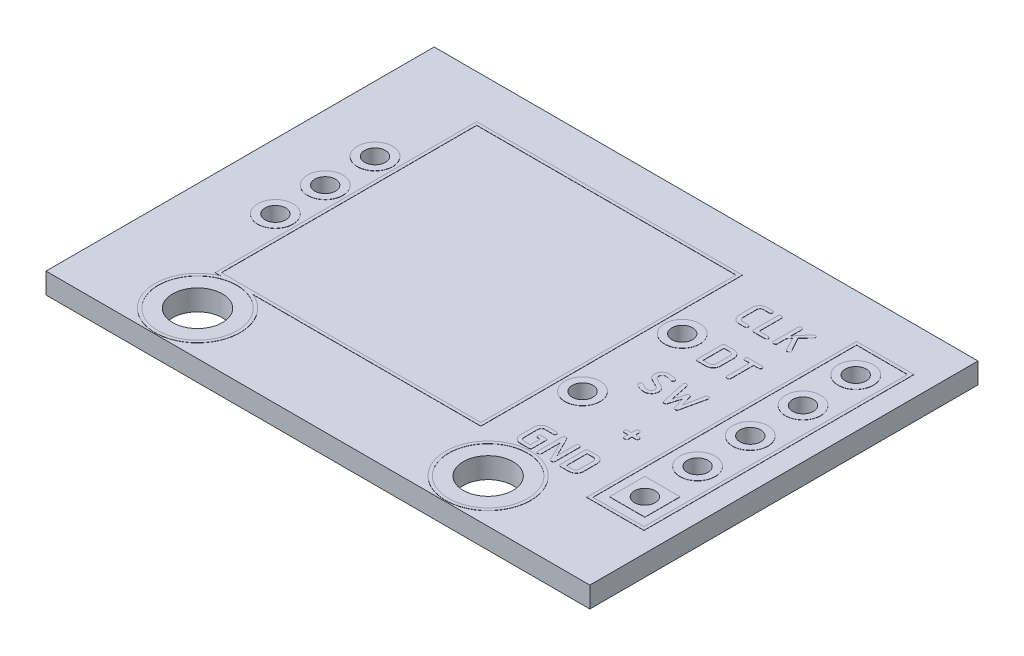
from build123d import *

# Parameters (mm, degrees)
EXTRUDE_1_DEPTH      = 0.5
EXTRUDE_1_DEPTH_BACK = 0.5
SKETCH_1_W           = 26.2
SKETCH_1_H           = 18.7
SKETCH_1_R           = 1.2
SKETCH_1_R_2         = 0.5
SKETCH_2_R           = 0.499436834
CUT_EXTRUDE_1_DEPTH  = 2
SKETCH_6_R           = 0.85
SKETCH_6_R_2         = 0.5
SKETCH_6_R_3         = 0.849436834
SKETCH_6_R_4         = 0.499436834
SKETCH_6_W           = 1.698284278
SKETCH_6_H           = 1.7
EXTRUDE_4_DEPTH      = 0.01
SKETCH_3_R           = 2.05
SKETCH_3_R_2         = 1.9
SKETCH_3_W           = 12.5
SKETCH_3_H           = 12.3
SKETCH_3_W_2         = 2.76
SKETCH_3_H_2         = 13
SKETCH_3_W_3         = 2.46
SKETCH_3_H_3         = 12.7
EXTRUDE_2_DEPTH      = 0.01
EXTRUDE_3_DEPTH      = 0.01


with BuildPart() as part:
    # 草图1 → 凸台-拉伸1 (new, two sides: drawn at the far end of the back side and taken through both)
    with BuildSketch(Plane(origin=(0, 0, 0), x_dir=(1, 0, 0), z_dir=(0, 1, 0)).offset(-EXTRUDE_1_DEPTH_BACK)):
        with Locations((13.1, 9.35)):
            Rectangle(SKETCH_1_W, SKETCH_1_H)
        with Locations((19.2, 2.1)):
            Circle(SKETCH_1_R, mode=Mode.SUBTRACT)
        with Locations((5.2, 2.1)):
            Circle(SKETCH_1_R, mode=Mode.SUBTRACT)
        with Locations((23.85, 5)):
            Circle(SKETCH_1_R_2, mode=Mode.SUBTRACT)
        with Locations((23.85, 7.54)):
            Circle(SKETCH_1_R_2, mode=Mode.SUBTRACT)
        with Locations((23.85, 10.08)):
            Circle(SKETCH_1_R_2, mode=Mode.SUBTRACT)
        with Locations((23.85, 12.62)):
            Circle(SKETCH_1_R_2, mode=Mode.SUBTRACT)
        with Locations((23.85, 15.16)):
            Circle(SKETCH_1_R_2, mode=Mode.SUBTRACT)
    extrude(amount=EXTRUDE_1_DEPTH + EXTRUDE_1_DEPTH_BACK)

    # 草图2 → 切除-拉伸1 (cut)
    with BuildSketch(Plane.XZ.offset(0.5)):
        with Locations((3.15, -7.9)):
            Circle(SKETCH_2_R)
        with Locations((17.95, -7.9)):
            Circle(SKETCH_2_R)
        with Locations((17.95, -12.7)):
            Circle(SKETCH_2_R)
        with Locations((3.15, -10.3)):
            Circle(SKETCH_2_R)
        with Locations((3.15, -12.7)):
            Circle(SKETCH_2_R)
    extrude(amount=-CUT_EXTRUDE_1_DEPTH, mode=Mode.SUBTRACT)

    # 草图6 → 凸台-拉伸4 (add)
    # profile 1 of 10: a face of its own
    with BuildSketch(Plane(origin=(0, 0.5, 0), x_dir=(1, 0, 0), z_dir=(0, 1, 0))):
        with Locations((23.85, 15.16)):
            Circle(SKETCH_6_R)
        with Locations((23.85, 15.16)):
            Circle(SKETCH_6_R_2, mode=Mode.SUBTRACT)
    # profile 2 of 10: a face of its own
    with BuildSketch(Plane(origin=(0, 0.5, 0), x_dir=(1, 0, 0), z_dir=(0, 1, 0))):
        with Locations((23.85, 12.62)):
            Circle(SKETCH_6_R)
        with Locations((23.85, 12.62)):
            Circle(SKETCH_6_R_2, mode=Mode.SUBTRACT)
    # profile 3 of 10: a face of its own
    with BuildSketch(Plane(origin=(0, 0.5, 0), x_dir=(1, 0, 0), z_dir=(0, 1, 0))):
        with Locations((23.85, 10.08)):
            Circle(SKETCH_6_R)
        with Locations((23.85, 10.08)):
            Circle(SKETCH_6_R_2, mode=Mode.SUBTRACT)
    # profile 4 of 10: a face of its own
    with BuildSketch(Plane(origin=(0, 0.5, 0), x_dir=(1, 0, 0), z_dir=(0, 1, 0))):
        with Locations((23.85, 7.54)):
            Circle(SKETCH_6_R)
        with Locations((23.85, 7.54)):
            Circle(SKETCH_6_R_2, mode=Mode.SUBTRACT)
    # profile 5 of 10: a face of its own
    with BuildSketch(Plane(origin=(0, 0.5, 0), x_dir=(1, 0, 0), z_dir=(0, 1, 0))):
        with Locations((3.15, 7.9)):
            Circle(SKETCH_6_R_3)
        with Locations((3.15, 7.9)):
            Circle(SKETCH_6_R_4, mode=Mode.SUBTRACT)
    # profile 6 of 10: a face of its own
    with BuildSketch(Plane(origin=(0, 0.5, 0), x_dir=(1, 0, 0), z_dir=(0, 1, 0))):
        with Locations((17.95, 7.9)):
            Circle(SKETCH_6_R_3)
        with Locations((17.95, 7.9)):
            Circle(SKETCH_6_R_4, mode=Mode.SUBTRACT)
    # profile 7 of 10: a face of its own
    with BuildSketch(Plane(origin=(0, 0.5, 0), x_dir=(1, 0, 0), z_dir=(0, 1, 0))):
        with Locations((17.95, 12.7)):
            Circle(SKETCH_6_R_3)
        with Locations((17.95, 12.7)):
            Circle(SKETCH_6_R_4, mode=Mode.SUBTRACT)
    # profile 8 of 10: a face of its own
    with BuildSketch(Plane(origin=(0, 0.5, 0), x_dir=(1, 0, 0), z_dir=(0, 1, 0))):
        with Locations((3.15, 10.3)):
            Circle(SKETCH_6_R_3)
        with Locations((3.15, 10.3)):
            Circle(SKETCH_6_R_4, mode=Mode.SUBTRACT)
    # profile 9 of 10: a face of its own
    with BuildSketch(Plane(origin=(0, 0.5, 0), x_dir=(1, 0, 0), z_dir=(0, 1, 0))):
        with Locations((3.15, 12.7)):
            Circle(SKETCH_6_R_3)
        with Locations((3.15, 12.7)):
            Circle(SKETCH_6_R_4, mode=Mode.SUBTRACT)
    # profile 10 of 10: a face of its own
    with BuildSketch(Plane(origin=(0, 0.5, 0), x_dir=(1, 0, 0), z_dir=(0, 1, 0))):
        with Locations((23.85, 5)):
            Rectangle(SKETCH_6_W, SKETCH_6_H)
        with Locations((23.85, 5)):
            Circle(SKETCH_6_R_2, mode=Mode.SUBTRACT)
    extrude_4 = extrude(amount=EXTRUDE_4_DEPTH)

    # 镜向1: 凸台-拉伸4 across plane
    add(extrude_4.mirror(Plane.ZX))

    # 草图3 → 凸台-拉伸2 (add)
    # profile 1 of 3: a face of its own
    with BuildSketch(Plane(origin=(0, 0.5, 0), x_dir=(1, 0, 0), z_dir=(0, 1, 0))):
        with Locations((19.2, 2.1)):
            Circle(SKETCH_3_R)
        with Locations((19.2, 2.1)):
            Circle(SKETCH_3_R_2, mode=Mode.SUBTRACT)
    # profile 2 of 3: a face of its own
    with BuildSketch(Plane(origin=(0, 0.5, 0), x_dir=(1, 0, 0), z_dir=(0, 1, 0))):
        with BuildLine():
            Line((16.95, 16.6), (4.15, 16.6))
            Line((4.15, 16.6), (4.15, 4))
            Line((4.15, 4), (4.430259784, 4))
            ThreePointArc((4.430259784, 4), (5.2, 0.05), (5.969740216, 4))
            Line((5.969740216, 4), (16.95, 4))
            Line((16.95, 4), (16.95, 16.6))
        make_face()
        with Locations((5.2, 2.1)):
            Circle(SKETCH_3_R_2, mode=Mode.SUBTRACT)
        with Locations((10.55, 10.3)):
            Rectangle(SKETCH_3_W, SKETCH_3_H, mode=Mode.SUBTRACT)
    # profile 3 of 3: a face of its own
    with BuildSketch(Plane(origin=(0, 0.5, 0), x_dir=(1, 0, 0), z_dir=(0, 1, 0))):
        with Locations((23.85, 10.08)):
            Rectangle(SKETCH_3_W_2, SKETCH_3_H_2)
        with Locations((23.85, 10.08)):
            Rectangle(SKETCH_3_W_3, SKETCH_3_H_3, mode=Mode.SUBTRACT)
    extrude(amount=EXTRUDE_2_DEPTH)

    # 草图4 → 凸台-拉伸3 (add)
    # profile 1 of 11: a face of its own
    with BuildSketch(Plane(origin=(0, 0.5, 0), x_dir=(1, 0, 0), z_dir=(0, 1, 0))):
        with BuildLine():
            Line((20.793402424, 15.176723836), (20.65990912, 15.007069819))
            Line((20.65990912, 15.007069819), (20.65990912, 14.57615464))
            add(Edge.make_bspline(
                [(20.65990912, 14.57615464), (20.659726109, 14.569476232), (20.659378633, 14.55679625), (20.653887314, 14.539236285), (20.645942654, 14.523830586), (20.633492874, 14.51195255), (20.618336627, 14.502234837), (20.599607799, 14.496005691), (20.577854677, 14.491529766), (20.562203407, 14.491299852), (20.553837692, 14.491176961)],
                knots=[0, 0, 0, 0, 1.028054548, 1.951919403, 2.820883235, 3.677544513, 4.578137139, 5.585329752, 6.709341418, 8, 8, 8, 8], degree=3))
            add(Edge.make_bspline(
                [(20.553837692, 14.491176961), (20.547081069, 14.491327286), (20.534220241, 14.491613419), (20.516364836, 14.495902146), (20.501012695, 14.502578346), (20.488382828, 14.511974647), (20.478661696, 14.524381271), (20.471732965, 14.539305561), (20.467940957, 14.556988695), (20.467360299, 14.569507373), (20.467051977, 14.57615464)],
                knots=[0, 0, 0, 0, 1.163568472, 2.214783019, 3.14592832, 4.036996539, 4.900661769, 5.839040936, 6.85255686, 8, 8, 8, 8], degree=3))
            Line((20.467051977, 14.57615464), (20.467051977, 15.756199283))
            add(Edge.make_bspline(
                [(20.467051977, 15.756199283), (20.467362721, 15.762844399), (20.46794794, 15.775359025), (20.471709529, 15.793069179), (20.478774006, 15.807974988), (20.488177735, 15.820695916), (20.501134816, 15.829718266), (20.516344021, 15.836477111), (20.534226388, 15.840733023), (20.547083186, 15.84102406), (20.553837692, 15.841176961)],
                knots=[0, 0, 0, 0, 1.146971392, 2.160070629, 3.098064001, 3.975005754, 4.855365065, 5.786127544, 6.836909906, 8, 8, 8, 8], degree=3))
            add(Edge.make_bspline(
                [(20.553837692, 15.841176961), (20.56220103, 15.841050621), (20.57784785, 15.840814252), (20.599630052, 15.83638052), (20.618215308, 15.83003349), (20.633694626, 15.820757283), (20.645836059, 15.808508113), (20.65390823, 15.793140273), (20.659372562, 15.775551104), (20.659724014, 15.762875424), (20.65990912, 15.756199283)],
                knots=[0, 0, 0, 0, 1.290199789, 2.413811901, 3.420646485, 4.312714334, 5.18011951, 6.04877445, 6.972310897, 8, 8, 8, 8], degree=3))
            Line((20.65990912, 15.756199283), (20.65990912, 15.224335444))
            Line((20.65990912, 15.224335444), (21.149886799, 15.812549729))
            add(Edge.make_bspline(
                [(21.149886799, 15.812549729), (21.154323035, 15.817001228), (21.162875857, 15.825583473), (21.17867965, 15.834502796), (21.195798188, 15.840223101), (21.20789775, 15.840854674), (21.214072067, 15.841176961)],
                knots=[0, 0, 0, 0, 1.037265406, 1.999790961, 2.979308193, 4, 4, 4, 4], degree=3))
            add(Edge.make_bspline(
                [(21.214072067, 15.841176961), (21.222229408, 15.841028367), (21.237665821, 15.840747178), (21.259115017, 15.8365146), (21.277369888, 15.829865046), (21.292730914, 15.820867507), (21.304542938, 15.808391349), (21.312651216, 15.793155887), (21.318095798, 15.775546572), (21.31845016, 15.762873861), (21.318636799, 15.756199283)],
                knots=[0, 0, 0, 0, 1.270448917, 2.404113486, 3.39054033, 4.290589112, 5.154891296, 6.031317705, 6.963116621, 8, 8, 8, 8], degree=3))
            add(Edge.make_bspline(
                [(21.318636799, 15.756199283), (21.318230126, 15.751640429), (21.317375737, 15.742062626), (21.311847793, 15.727537814), (21.302530809, 15.712803075), (21.294556862, 15.70336677), (21.290310906, 15.69834214)],
                knots=[0, 0, 0, 0, 0.831966467, 1.747898068, 2.800804038, 4, 4, 4, 4], degree=3))
            Line((21.290310906, 15.69834214), (20.924183674, 15.298163569))
            Line((20.924183674, 15.298163569), (21.304172513, 14.618040801))
            add(Edge.make_bspline(
                [(21.304172513, 14.618040801), (21.308365999, 14.610595213), (21.315757521, 14.597471469), (21.31776726, 14.582592302), (21.318636799, 14.57615464)],
                knots=[0, 0, 0, 0, 1.134674476, 2, 2, 2, 2], degree=3))
            add(Edge.make_bspline(
                [(21.318636799, 14.57615464), (21.318272383, 14.571482872), (21.317519933, 14.561836539), (21.31150802, 14.547611672), (21.302216127, 14.533374803), (21.289865569, 14.519226955), (21.274581907, 14.506495314), (21.256208504, 14.497781893), (21.235911037, 14.492056458), (21.221547473, 14.49147801), (21.214072067, 14.491176961)],
                knots=[0, 0, 0, 0, 0.756511836, 1.562056281, 2.471351599, 3.511475476, 4.601537416, 5.673641561, 6.789264718, 8, 8, 8, 8], degree=3))
            add(Edge.make_bspline(
                [(21.214072067, 14.491176961), (21.205940442, 14.491596123), (21.190380771, 14.492398178), (21.168977061, 14.501439687), (21.150943286, 14.515773016), (21.142705615, 14.528748465), (21.138435906, 14.535473836)],
                knots=[0, 0, 0, 0, 1.051983491, 2.012945582, 2.970079655, 4, 4, 4, 4], degree=3))
            Line((21.138435906, 14.535473836), (20.793402424, 15.176723836))
        make_face()
    # profile 2 of 11: a face of its own
    with BuildSketch(Plane(origin=(0, 0.5, 0), x_dir=(1, 0, 0), z_dir=(0, 1, 0))):
        with BuildLine():
            add(Edge.make_bspline(
                [(19.502766263, 15.756199283), (19.503077007, 15.762844399), (19.503662225, 15.775359025), (19.507423815, 15.793069179), (19.514488291, 15.807974988), (19.523892021, 15.820695916), (19.536849101, 15.829718266), (19.552058306, 15.836477111), (19.569940674, 15.840733023), (19.582797472, 15.84102406), (19.589551977, 15.841176961)],
                knots=[0, 0, 0, 0, 1.146971392, 2.160070629, 3.098064001, 3.975005754, 4.855365065, 5.786127544, 6.836909906, 8, 8, 8, 8], degree=3))
            add(Edge.make_bspline(
                [(19.589551977, 15.841176961), (19.5979152, 15.841050558), (19.613561804, 15.840814072), (19.635345421, 15.836381105), (19.653926157, 15.830031633), (19.669420036, 15.820763294), (19.681447502, 15.808549636), (19.689704161, 15.793387513), (19.69507068, 15.775843529), (19.695432722, 15.763173688), (19.695623406, 15.756500622)],
                knots=[0, 0, 0, 0, 1.292391348, 2.417912051, 3.426456865, 4.320039998, 5.188918566, 6.045460059, 6.970565243, 8, 8, 8, 8], degree=3))
            Line((19.695623406, 15.756500622), (19.695623406, 14.66474839))
            Line((19.695623406, 14.66474839), (20.118101085, 14.66474839))
            add(Edge.make_bspline(
                [(20.118101085, 14.66474839), (20.126262043, 14.664605384), (20.1417053, 14.664334768), (20.163109352, 14.660032444), (20.181608597, 14.65356716), (20.196577445, 14.643755609), (20.208693094, 14.631355721), (20.216659031, 14.615787339), (20.222157395, 14.597816106), (20.222489675, 14.584840868), (20.222665817, 14.577962676)],
                knots=[0, 0, 0, 0, 1.258373533, 2.381262828, 3.358313866, 4.266397696, 5.122484846, 6.004202786, 6.942024946, 8, 8, 8, 8], degree=3))
            add(Edge.make_bspline(
                [(20.222665817, 14.577962676), (20.222459863, 14.571195054), (20.222065691, 14.558242628), (20.216827736, 14.540249467), (20.208477296, 14.524846345), (20.196802343, 14.512089195), (20.181416318, 14.502832644), (20.163245475, 14.495659343), (20.141635754, 14.492117937), (20.126246197, 14.491502624), (20.118101085, 14.491176961)],
                knots=[0, 0, 0, 0, 1.043515683, 1.997165386, 2.866106551, 3.734353395, 4.634922528, 5.618458819, 6.739540006, 8, 8, 8, 8], degree=3))
            Line((20.118101085, 14.491176961), (19.589551977, 14.491176961))
            add(Edge.make_bspline(
                [(19.589551977, 14.491176961), (19.582795355, 14.491327286), (19.569934527, 14.491613419), (19.552079121, 14.495902146), (19.536726981, 14.502578346), (19.524097114, 14.511974647), (19.514375981, 14.524381271), (19.50744725, 14.539305561), (19.503655242, 14.556988695), (19.503074585, 14.569507373), (19.502766263, 14.57615464)],
                knots=[0, 0, 0, 0, 1.163568472, 2.214783019, 3.14592832, 4.036996539, 4.900661769, 5.839040936, 6.85255686, 8, 8, 8, 8], degree=3))
            Line((19.502766263, 14.57615464), (19.502766263, 15.756199283))
        make_face()
    # profile 3 of 11: a face of its own
    with BuildSketch(Plane(origin=(0, 0.5, 0), x_dir=(1, 0, 0), z_dir=(0, 1, 0))):
        with BuildLine():
            add(Edge.make_bspline(
                [(19.15381537, 15.841176961), (19.161976328, 15.841033955), (19.177419586, 15.84076334), (19.198823638, 15.836461016), (19.217322883, 15.829995731), (19.232291731, 15.82018418), (19.24440738, 15.807784292), (19.252373317, 15.79221591), (19.25787168, 15.774244678), (19.25820396, 15.76126944), (19.258380102, 15.754391247)],
                knots=[0, 0, 0, 0, 1.258373533, 2.381262828, 3.358313866, 4.266397696, 5.122484846, 6.004202786, 6.942024946, 8, 8, 8, 8], degree=3))
            add(Edge.make_bspline(
                [(19.258380102, 15.754391247), (19.258174148, 15.747623625), (19.257779977, 15.734671199), (19.252542022, 15.716678038), (19.244191581, 15.701274916), (19.232516628, 15.688517766), (19.217130604, 15.679261216), (19.198959761, 15.672087915), (19.177350039, 15.668546509), (19.161960483, 15.667931195), (19.15381537, 15.667605533)],
                knots=[0, 0, 0, 0, 1.043515683, 1.997165386, 2.866106551, 3.734353395, 4.634922528, 5.618458819, 6.739540006, 8, 8, 8, 8], degree=3))
            Line((19.15381537, 15.667605533), (18.890143495, 15.667605533))
            add(Edge.make_bspline(
                [(18.890143495, 15.667605533), (18.880133597, 15.667029366), (18.860197559, 15.665881853), (18.831212746, 15.656432961), (18.804271464, 15.640414396), (18.779312161, 15.619330982), (18.757713677, 15.593408612), (18.742534375, 15.562623115), (18.732792194, 15.528373787), (18.731833406, 15.504148435), (18.731337692, 15.49162339)],
                knots=[0, 0, 0, 0, 0.911113442, 1.814603144, 2.745921518, 3.75301959, 4.781250055, 5.796804317, 6.860898865, 8, 8, 8, 8], degree=3))
            Line((18.731337692, 15.49162339), (18.731337692, 14.840730533))
            add(Edge.make_bspline(
                [(18.731337692, 14.840730533), (18.731837229, 14.828207665), (18.732803409, 14.803986524), (18.742530778, 14.769576563), (18.75799309, 14.738790121), (18.77950802, 14.712710485), (18.804717916, 14.691854406), (18.831672704, 14.676058492), (18.86048341, 14.666453744), (18.880230304, 14.665318365), (18.890143495, 14.66474839)],
                knots=[0, 0, 0, 0, 1.139595756, 2.204152357, 3.232462142, 4.261139086, 5.262785444, 6.202445166, 7.097604633, 8, 8, 8, 8], degree=3))
            Line((18.890143495, 14.66474839), (19.15381537, 14.66474839))
            add(Edge.make_bspline(
                [(19.15381537, 14.66474839), (19.161976328, 14.664605384), (19.177419586, 14.664334768), (19.198823638, 14.660032444), (19.217322883, 14.65356716), (19.232291731, 14.643755609), (19.24440738, 14.631355721), (19.252373317, 14.615787339), (19.25787168, 14.597816106), (19.25820396, 14.584840868), (19.258380102, 14.577962676)],
                knots=[0, 0, 0, 0, 1.258373533, 2.381262828, 3.358313866, 4.266397696, 5.122484846, 6.004202786, 6.942024946, 8, 8, 8, 8], degree=3))
            add(Edge.make_bspline(
                [(19.258380102, 14.577962676), (19.258174148, 14.571195054), (19.257779977, 14.558242628), (19.252542022, 14.540249467), (19.244191581, 14.524846345), (19.232516628, 14.512089195), (19.217130604, 14.502832644), (19.198959761, 14.495659343), (19.177350039, 14.492117937), (19.161960483, 14.491502624), (19.15381537, 14.491176961)],
                knots=[0, 0, 0, 0, 1.043515683, 1.997165386, 2.866106551, 3.734353395, 4.634922528, 5.618458819, 6.739540006, 8, 8, 8, 8], degree=3))
            Line((19.15381537, 14.491176961), (18.890143495, 14.491176961))
            add(Edge.make_bspline(
                [(18.890143495, 14.491176961), (18.878271098, 14.491421476), (18.854926262, 14.491902266), (18.820559217, 14.497061313), (18.787362748, 14.504642108), (18.755560103, 14.516051411), (18.724918757, 14.530082095), (18.695890979, 14.547950265), (18.667713538, 14.568307705), (18.641546334, 14.592020644), (18.617496717, 14.617786978), (18.596255703, 14.645237046), (18.57842104, 14.674256202), (18.563931536, 14.704607162), (18.552336796, 14.736042561), (18.544205663, 14.768875088), (18.539241008, 14.80311057), (18.538736914, 14.826450113), (18.538480549, 14.838319819)],
                knots=[0, 0, 0, 0, 1.036146725, 2.037387638, 3.029011966, 4.005699101, 4.983016459, 5.967005002, 6.977732936, 8.015215859, 9.045664413, 10.052883394, 11.041437129, 12.014571659, 12.985964629, 13.962612362, 14.963853275, 16, 16, 16, 16], degree=3))
            Line((18.538480549, 14.838319819), (18.538480549, 15.494034104))
            add(Edge.make_bspline(
                [(18.538480549, 15.494034104), (18.538694923, 15.505810989), (18.539118482, 15.529079637), (18.544751022, 15.563188903), (18.552164048, 15.596275189), (18.563920693, 15.627657605), (18.578425203, 15.65796743), (18.59664719, 15.686611776), (18.617434202, 15.7144807), (18.641869609, 15.73992982), (18.667982184, 15.763637172), (18.695956052, 15.784316761), (18.725261501, 15.801798971), (18.755767639, 15.816399338), (18.787590863, 15.827629206), (18.820645712, 15.83534251), (18.854928976, 15.840442386), (18.878272013, 15.840929322), (18.890143495, 15.841176961)],
                knots=[0, 0, 0, 0, 1.027896695, 2.030907772, 3.014489256, 3.986369227, 4.952086044, 5.945759404, 6.948155796, 7.985119216, 9.023122273, 10.027284869, 11.019289852, 12.00083266, 12.97800945, 13.961590933, 14.963333811, 16, 16, 16, 16], degree=3))
            Line((18.890143495, 15.841176961), (19.15381537, 15.841176961))
        make_face()
    # profile 4 of 11: a face of its own
    with BuildSketch(Plane(origin=(0, 0.5, 0), x_dir=(1, 0, 0), z_dir=(0, 1, 0))):
        with BuildLine():
            add(Edge.make_bspline(
                [(20.465545281, 13.189391247), (20.465669361, 13.196255793), (20.465902126, 13.209133155), (20.470419523, 13.227000209), (20.476753477, 13.242443406), (20.486575697, 13.25492826), (20.498764399, 13.264818191), (20.513963226, 13.271432993), (20.531498592, 13.275748209), (20.544165705, 13.276029237), (20.550824299, 13.276176961)],
                knots=[0, 0, 0, 0, 1.177412005, 2.208734447, 3.152945062, 4.02767554, 4.913099734, 5.825774102, 6.857096544, 8, 8, 8, 8], degree=3))
            Line((20.550824299, 13.276176961), (21.21256537, 13.276176961))
            add(Edge.make_bspline(
                [(21.21256537, 13.276176961), (21.220726328, 13.276033955), (21.236169586, 13.27576334), (21.257573638, 13.271461016), (21.276072883, 13.264995731), (21.291041731, 13.25518418), (21.30315738, 13.242784292), (21.311123317, 13.22721591), (21.31662168, 13.209244678), (21.31695396, 13.19626944), (21.317130102, 13.189391247)],
                knots=[0, 0, 0, 0, 1.258373533, 2.381262828, 3.358313866, 4.266397696, 5.122484846, 6.004202786, 6.942024946, 8, 8, 8, 8], degree=3))
            add(Edge.make_bspline(
                [(21.317130102, 13.189391247), (21.316924148, 13.182623625), (21.316529977, 13.169671199), (21.311292022, 13.151678038), (21.302941581, 13.136274916), (21.291266628, 13.123517766), (21.275880604, 13.114261216), (21.257709761, 13.107087915), (21.236100039, 13.103546509), (21.220710483, 13.102931195), (21.21256537, 13.102605533)],
                knots=[0, 0, 0, 0, 1.043515683, 1.997165386, 2.866106551, 3.734353395, 4.634922528, 5.618458819, 6.739540006, 8, 8, 8, 8], degree=3))
            Line((21.21256537, 13.102605533), (20.987766263, 13.102605533))
            Line((20.987766263, 13.102605533), (20.987766263, 12.010853301))
            add(Edge.make_bspline(
                [(20.987766263, 12.010853301), (20.987575579, 12.004180235), (20.987213537, 11.991510394), (20.981847018, 11.97396641), (20.973590359, 11.958804287), (20.961562893, 11.946590629), (20.946069014, 11.937322289), (20.927488278, 11.930972818), (20.905704661, 11.926539851), (20.890058057, 11.926303365), (20.881694835, 11.926176961)],
                knots=[0, 0, 0, 0, 1.029434757, 1.954539941, 2.811081434, 3.679960002, 4.573543135, 5.582087949, 6.707608652, 8, 8, 8, 8], degree=3))
            add(Edge.make_bspline(
                [(20.881694835, 11.926176961), (20.87494041, 11.926329901), (20.862083768, 11.926621012), (20.844200362, 11.930876436), (20.828994533, 11.937636867), (20.816025822, 11.946653751), (20.806720236, 11.959321237), (20.799494598, 11.974048311), (20.795820998, 11.991700936), (20.795225384, 12.004210744), (20.79490912, 12.010853301)],
                knots=[0, 0, 0, 0, 1.165370898, 2.21821383, 3.150801522, 4.032887205, 4.911548629, 5.835693501, 6.850779413, 8, 8, 8, 8], degree=3))
            Line((20.79490912, 12.010853301), (20.79490912, 13.102605533))
            Line((20.79490912, 13.102605533), (20.550824299, 13.102605533))
            add(Edge.make_bspline(
                [(20.550824299, 13.102605533), (20.544183373, 13.102931982), (20.531578774, 13.103551588), (20.513810231, 13.10713836), (20.498970829, 13.114404444), (20.486348146, 13.123812824), (20.476958657, 13.136583009), (20.470266749, 13.151913197), (20.465982836, 13.16977533), (20.465695983, 13.182635153), (20.465545281, 13.189391247)],
                knots=[0, 0, 0, 0, 1.145312486, 2.173824069, 3.094826245, 3.970499645, 4.859913264, 5.789329549, 6.838592125, 8, 8, 8, 8], degree=3))
        make_face()
    # profile 5 of 11: a face of its own
    with BuildSketch(Plane(origin=(0, 0.5, 0), x_dir=(1, 0, 0), z_dir=(0, 1, 0))):
        with BuildLine():
            add(Edge.make_bspline(
                [(19.367766263, 13.191199283), (19.367899775, 13.19786041), (19.368151803, 13.210434459), (19.372614248, 13.227935422), (19.379090881, 13.243065607), (19.388601079, 13.255579573), (19.401206441, 13.264732071), (19.41615077, 13.27147525), (19.433729466, 13.275735709), (19.446390095, 13.27602493), (19.453045281, 13.276176961)],
                knots=[0, 0, 0, 0, 1.155654958, 2.181502266, 3.120276192, 4.004766136, 4.878658842, 5.80151602, 6.844345042, 8, 8, 8, 8], degree=3))
            Line((19.453045281, 13.276176961), (19.848402424, 13.276176961))
            add(Edge.make_bspline(
                [(19.848402424, 13.276176961), (19.861475817, 13.275921832), (19.887113307, 13.275421513), (19.924653849, 13.270480313), (19.960486192, 13.262351231), (19.994502457, 13.250919228), (20.0268267, 13.236311344), (20.05736278, 13.218490015), (20.086147507, 13.197269323), (20.112684164, 13.172924985), (20.136849041, 13.146690425), (20.158212653, 13.119170712), (20.176006633, 13.090305497), (20.191029488, 13.06048968), (20.202098208, 13.029131434), (20.210207884, 12.996751707), (20.215646888, 12.963267867), (20.216106196, 12.940506194), (20.216337692, 12.929034104)],
                knots=[0, 0, 0, 0, 1.113136271, 2.182908376, 3.21864008, 4.238702795, 5.234322143, 6.235148626, 7.244823614, 8.274494106, 9.297852902, 10.28018464, 11.2370332, 12.182180518, 13.118612311, 14.06282967, 15.023648573, 16, 16, 16, 16], degree=3))
            Line((20.216337692, 12.929034104), (20.216337692, 12.273319819))
            add(Edge.make_bspline(
                [(20.216337692, 12.273319819), (20.216108775, 12.261946999), (20.215654593, 12.239382815), (20.210178154, 12.206213422), (20.202198098, 12.174046624), (20.190563125, 12.143070652), (20.175720911, 12.11308739), (20.15754297, 12.084205846), (20.136370156, 12.056181699), (20.111742136, 12.030050728), (20.084995878, 12.005728949), (20.056111041, 11.984620855), (20.025906788, 11.966107307), (19.993420509, 11.951916432), (19.959604855, 11.940246935), (19.924022918, 11.932282507), (19.886841691, 11.926824856), (19.861380639, 11.92639571), (19.848402424, 11.926176961)],
                knots=[0, 0, 0, 0, 0.969451523, 1.923435434, 2.860952701, 3.793874942, 4.740631744, 5.710916422, 6.701728193, 7.732653437, 8.77043206, 9.781826416, 10.781348464, 11.786477098, 12.800156766, 13.829299079, 14.893532626, 16, 16, 16, 16], degree=3))
            Line((19.848402424, 11.926176961), (19.453045281, 11.926176961))
            add(Edge.make_bspline(
                [(19.453045281, 11.926176961), (19.446387979, 11.926326469), (19.433723324, 11.926610887), (19.41617153, 11.930903441), (19.401083716, 11.937567137), (19.388806848, 11.947088941), (19.37898071, 11.959291933), (19.37263812, 11.974439494), (19.368144698, 11.991913216), (19.367897315, 12.00449135), (19.367766263, 12.01115464)],
                knots=[0, 0, 0, 0, 1.156110421, 2.199350441, 3.122571333, 4.00740987, 4.878494053, 5.817637966, 6.843889579, 8, 8, 8, 8], degree=3))
            Line((19.367766263, 12.01115464), (19.367766263, 13.191199283))
        make_face()
        with BuildLine():
            Line((19.560623406, 13.102605533), (19.560623406, 12.09974839))
            Line((19.560623406, 12.09974839), (19.847498406, 12.09974839))
            add(Edge.make_bspline(
                [(19.847498406, 12.09974839), (19.859218664, 12.100382437), (19.882268974, 12.101629422), (19.915345043, 12.111602868), (19.945675797, 12.128024898), (19.972359644, 12.150573817), (19.994944537, 12.177380065), (20.011616579, 12.207735945), (20.021591662, 12.240964191), (20.022843854, 12.264011699), (20.023480549, 12.275730533)],
                knots=[0, 0, 0, 0, 1.016742171, 1.999633521, 2.971814917, 3.994083713, 5.01635251, 6.000366479, 6.983257829, 8, 8, 8, 8], degree=3))
            Line((20.023480549, 12.275730533), (20.023480549, 12.92662339))
            add(Edge.make_bspline(
                [(20.023480549, 12.92662339), (20.022855917, 12.938345536), (20.021632586, 12.961303138), (20.011547176, 12.994395833), (19.994949292, 13.024671404), (19.972364729, 13.051489713), (19.94554642, 13.074074276), (19.915270849, 13.09067216), (19.882178154, 13.10075757), (19.859220552, 13.101980901), (19.847498406, 13.102605533)],
                knots=[0, 0, 0, 0, 1.017364522, 1.992489184, 2.97710547, 4, 5.02289453, 6.007510816, 6.982635478, 8, 8, 8, 8], degree=3))
            Line((19.847498406, 13.102605533), (19.560623406, 13.102605533))
        make_face(mode=Mode.SUBTRACT)
    # profile 6 of 11: a face of its own
    with BuildSketch(Plane(origin=(0, 0.5, 0), x_dir=(1, 0, 0), z_dir=(0, 1, 0))):
        with BuildLine():
            Line((20.924786352, 9.711634551), (21.114328763, 10.64427964))
            add(Edge.make_bspline(
                [(21.114328763, 10.64427964), (21.115668637, 10.649556136), (21.118237932, 10.659674161), (21.124628153, 10.673485224), (21.132959653, 10.68507233), (21.142535662, 10.694920942), (21.154091635, 10.702369077), (21.167350227, 10.707372122), (21.182150884, 10.710881616), (21.192654652, 10.711076111), (21.198101085, 10.711176961)],
                knots=[0, 0, 0, 0, 1.109325827, 2.127204405, 3.082701347, 4.010309195, 4.914290067, 5.86206079, 6.89143191, 8, 8, 8, 8], degree=3))
            add(Edge.make_bspline(
                [(21.198101085, 10.711176961), (21.206258426, 10.711028367), (21.221694839, 10.710747178), (21.243144035, 10.7065146), (21.261398906, 10.699865046), (21.276759932, 10.690867507), (21.288571956, 10.678391349), (21.296680234, 10.663155887), (21.302124816, 10.645546572), (21.302479178, 10.632873861), (21.302665817, 10.626199283)],
                knots=[0, 0, 0, 0, 1.270448917, 2.404113486, 3.39054033, 4.290589112, 5.154891296, 6.031317705, 6.963116621, 8, 8, 8, 8], degree=3))
            add(Edge.make_bspline(
                [(21.302665817, 10.626199283), (21.302307764, 10.623278827), (21.301525139, 10.616895361), (21.300115701, 10.610619528), (21.299351085, 10.607214908)],
                knots=[0, 0, 0, 0, 0.915006323, 2, 2, 2, 2], degree=3))
            Line((21.299351085, 10.607214908), (21.036884567, 9.430786336))
            add(Edge.make_bspline(
                [(21.036884567, 9.430786336), (21.035485381, 9.42529028), (21.032775138, 9.414644341), (21.025352407, 9.400189741), (21.015656311, 9.388060752), (21.003697341, 9.377990736), (20.989554853, 9.37029012), (20.973153949, 9.364744533), (20.954512473, 9.361949356), (20.941367975, 9.361443824), (20.93442921, 9.361176961)],
                knots=[0, 0, 0, 0, 0.999891327, 1.936803349, 2.846230943, 3.72821105, 4.681795413, 5.675520856, 6.772945556, 8, 8, 8, 8], degree=3))
            add(Edge.make_bspline(
                [(20.93442921, 9.361176961), (20.929491973, 9.361437926), (20.920023315, 9.361938404), (20.906307858, 9.364968308), (20.893761558, 9.370417505), (20.882643751, 9.378465563), (20.872372851, 9.388249741), (20.863742883, 9.400517292), (20.856118746, 9.414784938), (20.852330053, 9.425304165), (20.850355549, 9.430786336)],
                knots=[0, 0, 0, 0, 1.006322891, 1.929931374, 2.846481486, 3.772129093, 4.713040589, 5.724347363, 6.814027286, 8, 8, 8, 8], degree=3))
            Line((20.850355549, 9.430786336), (20.680098852, 10.006947051))
            Line((20.680098852, 10.006947051), (20.510444835, 9.430786336))
            add(Edge.make_bspline(
                [(20.510444835, 9.430786336), (20.508406209, 9.425283528), (20.504454862, 9.414617765), (20.495842426, 9.400296678), (20.48561514, 9.387982702), (20.473147758, 9.378251662), (20.459315078, 9.370320179), (20.443502558, 9.364781981), (20.425968312, 9.361988489), (20.413723549, 9.361453712), (20.407386799, 9.361176961)],
                knots=[0, 0, 0, 0, 1.046742157, 2.028837417, 2.971247369, 3.890811817, 4.839356871, 5.810231589, 6.866779507, 8, 8, 8, 8], degree=3))
            add(Edge.make_bspline(
                [(20.407386799, 9.361176961), (20.402040354, 9.361405468), (20.391740415, 9.361845687), (20.377120584, 9.365293975), (20.363719232, 9.370488776), (20.352640684, 9.379153986), (20.342245997, 9.388916958), (20.334672218, 9.401847967), (20.327711095, 9.416338636), (20.325023894, 9.427199351), (20.323614477, 9.432895711)],
                knots=[0, 0, 0, 0, 1.060165962, 2.042412489, 2.972223091, 3.885846824, 4.816726542, 5.785103444, 6.838303844, 8, 8, 8, 8], degree=3))
            Line((20.323614477, 9.432895711), (20.06114796, 10.606913569))
            add(Edge.make_bspline(
                [(20.06114796, 10.606913569), (20.060447055, 10.610417418), (20.059172391, 10.616789511), (20.058872316, 10.623278445), (20.058737245, 10.626199283)],
                knots=[0, 0, 0, 0, 1.099748117, 2, 2, 2, 2], degree=3))
            add(Edge.make_bspline(
                [(20.058737245, 10.626199283), (20.058870757, 10.63286041), (20.059122785, 10.645434459), (20.06358523, 10.662935422), (20.070061863, 10.678065607), (20.079572062, 10.690579573), (20.092177423, 10.699732071), (20.107121752, 10.70647525), (20.124700448, 10.710735709), (20.137361077, 10.71102493), (20.144016263, 10.711176961)],
                knots=[0, 0, 0, 0, 1.155654958, 2.181502266, 3.120276192, 4.004766136, 4.878658842, 5.80151602, 6.844345042, 8, 8, 8, 8], degree=3))
            add(Edge.make_bspline(
                [(20.144016263, 10.711176961), (20.150864356, 10.711080111), (20.163948608, 10.710895065), (20.18235538, 10.707432853), (20.198674615, 10.70242048), (20.212907056, 10.695152708), (20.224731585, 10.685408231), (20.234324145, 10.673619318), (20.24171713, 10.659802121), (20.244651583, 10.64957341), (20.246170281, 10.64427964)],
                knots=[0, 0, 0, 0, 1.229764827, 2.34963995, 3.355254675, 4.292662221, 5.204116337, 6.0901464, 7.011573738, 8, 8, 8, 8], degree=3))
            Line((20.246170281, 10.64427964), (20.435110013, 9.709826515))
            Line((20.435110013, 9.709826515), (20.587889031, 10.252237229))
            add(Edge.make_bspline(
                [(20.587889031, 10.252237229), (20.589896645, 10.2576005), (20.593731416, 10.267844959), (20.600888652, 10.282034591), (20.609749795, 10.29374725), (20.619464314, 10.303810707), (20.630752636, 10.311242939), (20.643075281, 10.316998058), (20.656774523, 10.319803007), (20.666228136, 10.320357776), (20.671058674, 10.320641247)],
                knots=[0, 0, 0, 0, 1.182968556, 2.259604929, 3.268094629, 4.20716145, 5.133765294, 6.043959474, 7.000516767, 8, 8, 8, 8], degree=3))
            add(Edge.make_bspline(
                [(20.671058674, 10.320641247), (20.677393555, 10.320366921), (20.689535839, 10.31984111), (20.706997714, 10.317047547), (20.722483617, 10.311340964), (20.736680009, 10.304385637), (20.748548872, 10.294280971), (20.758982096, 10.282567851), (20.767152712, 10.268310128), (20.77114408, 10.257922288), (20.773212692, 10.252538569)],
                knots=[0, 0, 0, 0, 1.148084335, 2.200572455, 3.184181613, 4.127801655, 5.045296266, 5.986283679, 6.956348519, 8, 8, 8, 8], degree=3))
            Line((20.773212692, 10.252538569), (20.924786352, 9.711634551))
        make_face()
    # profile 7 of 11: a face of its own
    with BuildSketch(Plane(origin=(0, 0.5, 0), x_dir=(1, 0, 0), z_dir=(0, 1, 0))):
        with BuildLine():
            add(Edge.make_bspline(
                [(19.811337692, 9.707114461), (19.811114316, 9.695841382), (19.810673108, 9.673574936), (19.805154208, 9.640809401), (19.797127511, 9.608970071), (19.785628115, 9.57798939), (19.770422665, 9.548229289), (19.752200406, 9.519354073), (19.730738918, 9.49158412), (19.706169419, 9.465319575), (19.679241488, 9.441007669), (19.650404932, 9.419491581), (19.619638914, 9.401706452), (19.58762902, 9.386799072), (19.553899493, 9.375232709), (19.518518692, 9.367313234), (19.481542009, 9.361820024), (19.456280456, 9.361394095), (19.443402424, 9.361176961)],
                knots=[0, 0, 0, 0, 0.963685848, 1.903460177, 2.835378737, 3.771016282, 4.724372772, 5.69020304, 6.689126959, 7.723052748, 8.763851864, 9.790210623, 10.79565931, 11.799453177, 12.807946962, 13.840084631, 14.898901489, 16, 16, 16, 16], degree=3))
            add(Edge.make_bspline(
                [(19.443402424, 9.361176961), (19.422792299, 9.361656639), (19.382057407, 9.362604699), (19.321865635, 9.36965207), (19.263409914, 9.381442315), (19.206687031, 9.397922756), (19.151877067, 9.419627281), (19.098715914, 9.445430905), (19.047483045, 9.476358334), (19.015221842, 9.500137357), (18.998926977, 9.512147944)],
                knots=[0, 0, 0, 0, 1.033903017, 2.043458237, 3.03575917, 4.022915055, 5.002749918, 5.989944395, 6.984737666, 8, 8, 8, 8], degree=3))
            add(Edge.make_bspline(
                [(18.998926977, 9.512147944), (18.993478903, 9.51685366), (18.982933409, 9.525962217), (18.971210346, 9.542832036), (18.964200374, 9.561651004), (18.963250557, 9.574767911), (18.962766263, 9.581455979)],
                knots=[0, 0, 0, 0, 1.063672122, 2.058882924, 3.010260192, 4, 4, 4, 4], degree=3))
            add(Edge.make_bspline(
                [(18.962766263, 9.581455979), (18.963018775, 9.587117582), (18.963515638, 9.598257827), (18.968562613, 9.614175294), (18.976704826, 9.628696203), (18.987441943, 9.641837352), (19.000416089, 9.652808901), (19.015032876, 9.660927106), (19.03093994, 9.665988636), (19.042081613, 9.666483501), (19.047743942, 9.666734997)],
                knots=[0, 0, 0, 0, 1.015260343, 1.997711639, 2.967636482, 3.994235514, 5.032363518, 6.002288361, 6.984739657, 8, 8, 8, 8], degree=3))
            add(Edge.make_bspline(
                [(19.047743942, 9.666734997), (19.057541565, 9.66612735), (19.077381317, 9.66489689), (19.095317243, 9.656313804), (19.104395727, 9.651969372)],
                knots=[0, 0, 0, 0, 0.987675928, 2, 2, 2, 2], degree=3))
            add(Edge.make_bspline(
                [(19.104395727, 9.651969372), (19.116304922, 9.645060452), (19.14197372, 9.630169126), (19.184408284, 9.607892858), (19.233493466, 9.583999785), (19.268503977, 9.567549599), (19.287007335, 9.558855533)],
                knots=[0, 0, 0, 0, 0.805612779, 1.736398854, 2.803667213, 4, 4, 4, 4], degree=3))
            add(Edge.make_bspline(
                [(19.287007335, 9.558855533), (19.298798683, 9.555106865), (19.322802352, 9.547475696), (19.360601718, 9.540250534), (19.400191101, 9.535556195), (19.427216153, 9.53502113), (19.44099171, 9.53474839)],
                knots=[0, 0, 0, 0, 0.947683057, 1.929200036, 2.944445297, 4, 4, 4, 4], degree=3))
            add(Edge.make_bspline(
                [(19.44099171, 9.53474839), (19.45291643, 9.535363356), (19.47617517, 9.536562826), (19.509642848, 9.546692948), (19.540218288, 9.563169605), (19.567029738, 9.5859787), (19.590073008, 9.61261949), (19.606524646, 9.64329328), (19.616639032, 9.676653321), (19.617858103, 9.699810643), (19.618480549, 9.711634551)],
                knots=[0, 0, 0, 0, 1.026566717, 2.002281517, 2.986723952, 4.001528685, 5.021900499, 6.006342934, 6.982057734, 8, 8, 8, 8], degree=3))
            add(Edge.make_bspline(
                [(19.618480549, 9.711634551), (19.618238617, 9.720300205), (19.617764808, 9.737271379), (19.612689819, 9.761640891), (19.605307547, 9.784414717), (19.594174887, 9.805209546), (19.58001035, 9.824167427), (19.562697216, 9.841322398), (19.542544081, 9.856829671), (19.527207197, 9.865029023), (19.519339924, 9.869234997)],
                knots=[0, 0, 0, 0, 1.053049363, 2.062335159, 3.017147507, 3.957689883, 4.918508625, 5.886609336, 6.915906158, 8, 8, 8, 8], degree=3))
            Line((19.519339924, 9.869234997), (19.150801977, 10.05787339))
            add(Edge.make_bspline(
                [(19.150801977, 10.05787339), (19.135918331, 10.066159569), (19.106997789, 10.082260514), (19.068225993, 10.1117147), (19.03564791, 10.145220406), (19.008821541, 10.182221055), (18.988113905, 10.222923129), (18.973227847, 10.26714763), (18.964472146, 10.315073611), (18.96334475, 10.348227566), (18.962766263, 10.365239461)],
                knots=[0, 0, 0, 0, 1.071171976, 2.081403509, 3.051497276, 4.00243169, 4.946724019, 5.914280996, 6.929779788, 8, 8, 8, 8], degree=3))
            add(Edge.make_bspline(
                [(18.962766263, 10.365239461), (18.963026019, 10.376908179), (18.963538884, 10.399947068), (18.968513625, 10.433879732), (18.97663652, 10.466471725), (18.987899853, 10.497742081), (19.002093715, 10.527797491), (19.01971576, 10.556551453), (19.040564574, 10.583954912), (19.064294201, 10.609759708), (19.090269215, 10.6332848), (19.117673624, 10.654262328), (19.146601155, 10.671829696), (19.176665325, 10.686501371), (19.208369704, 10.697143746), (19.240952836, 10.705469941), (19.275003641, 10.710408446), (19.298140988, 10.710917862), (19.30990912, 10.711176961)],
                knots=[0, 0, 0, 0, 1.027810564, 2.029324526, 3.014787355, 3.983609768, 4.953725454, 5.939029235, 6.949966303, 7.983706593, 9.023983271, 10.034920338, 11.02022412, 12.002142036, 12.97636857, 13.9618314, 14.963345361, 16, 16, 16, 16], degree=3))
            add(Edge.make_bspline(
                [(19.30990912, 10.711176961), (19.329802843, 10.710957074), (19.368419639, 10.710530238), (19.424542622, 10.706915895), (19.47701977, 10.700851132), (19.525907806, 10.693006889), (19.570945766, 10.6822063), (19.612119824, 10.668724846), (19.650114518, 10.653907661), (19.673051634, 10.640929258), (19.684172513, 10.634636783)],
                knots=[0, 0, 0, 0, 1.235727123, 2.398737772, 3.491606877, 4.516393412, 5.472871429, 6.364787982, 7.207180435, 8, 8, 8, 8], degree=3))
            add(Edge.make_bspline(
                [(19.684172513, 10.634636783), (19.692882494, 10.629049069), (19.708974541, 10.618725539), (19.727549333, 10.599467414), (19.739843278, 10.578839326), (19.741314816, 10.56406721), (19.742029656, 10.556891247)],
                knots=[0, 0, 0, 0, 1.222565387, 2.258739788, 3.154134825, 4, 4, 4, 4], degree=3))
            add(Edge.make_bspline(
                [(19.742029656, 10.556891247), (19.741639345, 10.55203068), (19.740838165, 10.542053528), (19.735413925, 10.527297076), (19.726282247, 10.512959377), (19.714274165, 10.499135255), (19.699205226, 10.486852581), (19.680992249, 10.478006511), (19.660136704, 10.472921179), (19.645428914, 10.47225871), (19.637766263, 10.471913569)],
                knots=[0, 0, 0, 0, 0.784975576, 1.611297878, 2.507483837, 3.519582885, 4.558641731, 5.625460375, 6.762882306, 8, 8, 8, 8], degree=3))
            add(Edge.make_bspline(
                [(19.637766263, 10.471913569), (19.632500732, 10.472425977), (19.620506173, 10.473593212), (19.609170368, 10.477729336), (19.602810906, 10.480049729)],
                knots=[0, 0, 0, 0, 0.877986725, 2, 2, 2, 2], degree=3))
            add(Edge.make_bspline(
                [(19.602810906, 10.480049729), (19.57866223, 10.489003109), (19.531031905, 10.50666256), (19.457770377, 10.523891628), (19.385015615, 10.535545309), (19.336471852, 10.536921056), (19.312319835, 10.537605533)],
                knots=[0, 0, 0, 0, 1.036852388, 2.045065204, 3.027359719, 4, 4, 4, 4], degree=3))
            add(Edge.make_bspline(
                [(19.312319835, 10.537605533), (19.302592855, 10.537070032), (19.283177606, 10.536001161), (19.255048519, 10.525803595), (19.228256706, 10.51026134), (19.203608815, 10.488896605), (19.181889162, 10.46307524), (19.166899639, 10.432077019), (19.157035194, 10.397682118), (19.156105784, 10.37334875), (19.155623406, 10.360719372)],
                knots=[0, 0, 0, 0, 0.888252011, 1.772969152, 2.708992554, 3.71416756, 4.747592653, 5.776500468, 6.84597083, 8, 8, 8, 8], degree=3))
            add(Edge.make_bspline(
                [(19.155623406, 10.360719372), (19.155780996, 10.351657241), (19.156087552, 10.334028909), (19.16055626, 10.308803526), (19.16685167, 10.285502121), (19.176900245, 10.264816767), (19.188777166, 10.245869587), (19.203907348, 10.229439348), (19.221521068, 10.215010552), (19.234945604, 10.207539707), (19.241806442, 10.203721604)],
                knots=[0, 0, 0, 0, 1.145974124, 2.229234082, 3.235681197, 4.191666325, 5.130228074, 6.057777632, 7.007394267, 8, 8, 8, 8], degree=3))
            Line((19.241806442, 10.203721604), (19.610344388, 10.015384551))
            add(Edge.make_bspline(
                [(19.610344388, 10.015384551), (19.626226264, 10.006590866), (19.657005114, 9.989548832), (19.698354462, 9.959031354), (19.733187379, 9.924894395), (19.761810035, 9.887616286), (19.784226451, 9.847014386), (19.799744096, 9.803120327), (19.809910114, 9.756194321), (19.810854017, 9.723743111), (19.811337692, 9.707114461)],
                knots=[0, 0, 0, 0, 1.118248844, 2.167150328, 3.156675616, 4.115204419, 5.054603744, 6.002575187, 6.976479522, 8, 8, 8, 8], degree=3))
        make_face()
    # profile 8 of 11: a face of its own
    with BuildSketch(Plane(origin=(0, 0.5, 0), x_dir=(1, 0, 0), z_dir=(0, 1, 0))):
        with BuildLine():
            Line((20.852766263, 7.181891247), (20.674373406, 7.181891247))
            add(Edge.make_bspline(
                [(20.674373406, 7.181891247), (20.66773248, 7.182217696), (20.655127881, 7.182837302), (20.637359338, 7.186424074), (20.622519936, 7.193690159), (20.609897253, 7.203098539), (20.600507765, 7.215868723), (20.593815856, 7.231198911), (20.589531943, 7.249061045), (20.58924509, 7.261920867), (20.589094388, 7.268676961)],
                knots=[0, 0, 0, 0, 1.145312486, 2.173824069, 3.094826245, 3.970499645, 4.859913264, 5.789329549, 6.838592125, 8, 8, 8, 8], degree=3))
            add(Edge.make_bspline(
                [(20.589094388, 7.268676961), (20.589218468, 7.275541508), (20.589451234, 7.288418869), (20.59396863, 7.306285924), (20.600302584, 7.32172912), (20.610124805, 7.334213974), (20.622313506, 7.344103905), (20.637512333, 7.350718707), (20.655047699, 7.355033924), (20.667714812, 7.355314951), (20.674373406, 7.355462676)],
                knots=[0, 0, 0, 0, 1.177412005, 2.208734447, 3.152945062, 4.02767554, 4.913099734, 5.825774102, 6.857096544, 8, 8, 8, 8], degree=3))
            Line((20.674373406, 7.355462676), (20.852766263, 7.355462676))
            Line((20.852766263, 7.355462676), (20.852766263, 7.538676961))
            add(Edge.make_bspline(
                [(20.852766263, 7.538676961), (20.853068914, 7.54552545), (20.8536354, 7.55834411), (20.857448458, 7.576417976), (20.864371422, 7.591640525), (20.87408379, 7.604328577), (20.886629491, 7.614095133), (20.902091787, 7.620719483), (20.919930786, 7.625031536), (20.932794066, 7.625314183), (20.939551977, 7.625462676)],
                knots=[0, 0, 0, 0, 1.168665945, 2.187450692, 3.13077332, 3.998165305, 4.889609683, 5.810236294, 6.849575788, 8, 8, 8, 8], degree=3))
            add(Edge.make_bspline(
                [(20.939551977, 7.625462676), (20.947919049, 7.625342096), (20.963572853, 7.625116505), (20.985309401, 7.620612322), (21.004143336, 7.614456661), (21.019224225, 7.604356896), (21.031672889, 7.592187991), (21.039601075, 7.576485752), (21.045119569, 7.558535073), (21.045448852, 7.545556776), (21.045623406, 7.538676961)],
                knots=[0, 0, 0, 0, 1.278044392, 2.391070584, 3.388419448, 4.288526959, 5.147760025, 6.021733234, 6.951317863, 8, 8, 8, 8], degree=3))
            Line((21.045623406, 7.538676961), (21.045623406, 7.355462676))
            Line((21.045623406, 7.355462676), (21.204730549, 7.355462676))
            add(Edge.make_bspline(
                [(21.204730549, 7.355462676), (21.212891507, 7.35531967), (21.228334764, 7.355049054), (21.249738817, 7.35074673), (21.268238061, 7.344281445), (21.283206909, 7.334469895), (21.295322559, 7.322070006), (21.303288496, 7.306501624), (21.308786859, 7.288530392), (21.309119139, 7.275555154), (21.309295281, 7.268676961)],
                knots=[0, 0, 0, 0, 1.258373533, 2.381262828, 3.358313866, 4.266397696, 5.122484846, 6.004202786, 6.942024946, 8, 8, 8, 8], degree=3))
            add(Edge.make_bspline(
                [(21.309295281, 7.268676961), (21.309089327, 7.26190934), (21.308695155, 7.248956913), (21.3034572, 7.230963753), (21.29510676, 7.215560631), (21.283431807, 7.202803481), (21.268045782, 7.19354693), (21.249874939, 7.186373629), (21.228265218, 7.182832223), (21.212875661, 7.182216909), (21.204730549, 7.181891247)],
                knots=[0, 0, 0, 0, 1.043515683, 1.997165386, 2.866106551, 3.734353395, 4.634922528, 5.618458819, 6.739540006, 8, 8, 8, 8], degree=3))
            Line((21.204730549, 7.181891247), (21.045623406, 7.181891247))
            Line((21.045623406, 7.181891247), (21.045623406, 7.013141247))
            add(Edge.make_bspline(
                [(21.045623406, 7.013141247), (21.045440059, 7.006663346), (21.045092293, 6.994376339), (21.039615859, 6.977389122), (21.031543031, 6.962561846), (21.019191942, 6.951030719), (21.004012457, 6.941639579), (20.98529954, 6.935698505), (20.963535678, 6.931619235), (20.947912646, 6.931331137), (20.939551977, 6.931176961)],
                knots=[0, 0, 0, 0, 1.011618099, 1.918794064, 2.772957897, 3.631037606, 4.53643251, 5.553070469, 6.690525261, 8, 8, 8, 8], degree=3))
            add(Edge.make_bspline(
                [(20.939551977, 6.931176961), (20.932800795, 6.931356551), (20.919972758, 6.931697792), (20.902109211, 6.935594367), (20.886758609, 6.941970567), (20.874112525, 6.951048701), (20.864465829, 6.963099178), (20.857432169, 6.977464557), (20.85365487, 6.994574298), (20.853074767, 7.006695222), (20.852766263, 7.013141247)],
                knots=[0, 0, 0, 0, 1.183433944, 2.248663129, 3.188621588, 4.084379446, 4.949056959, 5.871656737, 6.868126397, 8, 8, 8, 8], degree=3))
            Line((20.852766263, 7.013141247), (20.852766263, 7.181891247))
        make_face()
    # profile 9 of 11: a face of its own
    with BuildSketch(Plane(origin=(0, 0.5, 0), x_dir=(1, 0, 0), z_dir=(0, 1, 0))):
        with BuildLine():
            add(Edge.make_bspline(
                [(20.467051977, 5.496199283), (20.467185489, 5.50286041), (20.467437517, 5.515434459), (20.471899962, 5.532935422), (20.478376595, 5.548065607), (20.487886794, 5.560579573), (20.500492155, 5.569732071), (20.515436484, 5.57647525), (20.53301518, 5.580735709), (20.545675809, 5.58102493), (20.552330995, 5.581176961)],
                knots=[0, 0, 0, 0, 1.155654958, 2.181502266, 3.120276192, 4.004766136, 4.878658842, 5.80151602, 6.844345042, 8, 8, 8, 8], degree=3))
            Line((20.552330995, 5.581176961), (20.947688138, 5.581176961))
            add(Edge.make_bspline(
                [(20.947688138, 5.581176961), (20.960761532, 5.580921832), (20.986399022, 5.580421513), (21.023939563, 5.575480313), (21.059771907, 5.567351231), (21.093788171, 5.555919228), (21.126112415, 5.541311344), (21.156648494, 5.523490015), (21.185433222, 5.502269323), (21.211969878, 5.477924985), (21.236134755, 5.451690425), (21.257498367, 5.424170712), (21.275292347, 5.395305497), (21.290315202, 5.36548968), (21.301383922, 5.334131434), (21.309493598, 5.301751707), (21.314932602, 5.268267867), (21.31539191, 5.245506194), (21.315623406, 5.234034104)],
                knots=[0, 0, 0, 0, 1.113136271, 2.182908376, 3.21864008, 4.238702795, 5.234322143, 6.235148626, 7.244823614, 8.274494106, 9.297852902, 10.28018464, 11.2370332, 12.182180518, 13.118612311, 14.06282967, 15.023648573, 16, 16, 16, 16], degree=3))
            Line((21.315623406, 5.234034104), (21.315623406, 4.578319819))
            add(Edge.make_bspline(
                [(21.315623406, 4.578319819), (21.315394489, 4.566946999), (21.314940307, 4.544382815), (21.309463869, 4.511213422), (21.301483812, 4.479046624), (21.289848839, 4.448070652), (21.275006625, 4.41808739), (21.256828684, 4.389205846), (21.23565587, 4.361181699), (21.21102785, 4.335050728), (21.184281592, 4.310728949), (21.155396755, 4.289620855), (21.125192503, 4.271107307), (21.092706223, 4.256916432), (21.05889057, 4.245246935), (21.023308633, 4.237282507), (20.986127405, 4.231824856), (20.960666353, 4.23139571), (20.947688138, 4.231176961)],
                knots=[0, 0, 0, 0, 0.969451523, 1.923435434, 2.860952701, 3.793874942, 4.740631744, 5.710916422, 6.701728193, 7.732653437, 8.77043206, 9.781826416, 10.781348464, 11.786477098, 12.800156766, 13.829299079, 14.893532626, 16, 16, 16, 16], degree=3))
            Line((20.947688138, 4.231176961), (20.552330995, 4.231176961))
            add(Edge.make_bspline(
                [(20.552330995, 4.231176961), (20.545673694, 4.231326469), (20.533009039, 4.231610887), (20.515457244, 4.235903441), (20.50036943, 4.242567137), (20.488092562, 4.252088941), (20.478266424, 4.264291933), (20.471923835, 4.279439494), (20.467430412, 4.296913216), (20.467183029, 4.30949135), (20.467051977, 4.31615464)],
                knots=[0, 0, 0, 0, 1.156110421, 2.199350441, 3.122571333, 4.00740987, 4.878494053, 5.817637966, 6.843889579, 8, 8, 8, 8], degree=3))
            Line((20.467051977, 4.31615464), (20.467051977, 5.496199283))
        make_face()
        with BuildLine():
            Line((20.65990912, 5.407605533), (20.65990912, 4.40474839))
            Line((20.65990912, 4.40474839), (20.94678412, 4.40474839))
            add(Edge.make_bspline(
                [(20.94678412, 4.40474839), (20.958504379, 4.405382437), (20.981554688, 4.406629422), (21.014630757, 4.416602868), (21.044961511, 4.433024898), (21.071645359, 4.455573817), (21.094230251, 4.482380065), (21.110902293, 4.512735945), (21.120877376, 4.545964191), (21.122129568, 4.569011699), (21.122766263, 4.580730533)],
                knots=[0, 0, 0, 0, 1.016742171, 1.999633521, 2.971814917, 3.994083713, 5.01635251, 6.000366479, 6.983257829, 8, 8, 8, 8], degree=3))
            Line((21.122766263, 4.580730533), (21.122766263, 5.23162339))
            add(Edge.make_bspline(
                [(21.122766263, 5.23162339), (21.122141631, 5.243345536), (21.120918301, 5.266303138), (21.11083289, 5.299395833), (21.094235006, 5.329671404), (21.071650444, 5.356489713), (21.044832134, 5.379074276), (21.014556563, 5.39567216), (20.981463868, 5.40575757), (20.958506266, 5.406980901), (20.94678412, 5.407605533)],
                knots=[0, 0, 0, 0, 1.017364522, 1.992489184, 2.97710547, 4, 5.02289453, 6.007510816, 6.982635478, 8, 8, 8, 8], degree=3))
            Line((20.94678412, 5.407605533), (20.65990912, 5.407605533))
        make_face(mode=Mode.SUBTRACT)
    # profile 10 of 11: a face of its own
    with BuildSketch(Plane(origin=(0, 0.5, 0), x_dir=(1, 0, 0), z_dir=(0, 1, 0))):
        with BuildLine():
            Line((20.023480549, 4.588565354), (20.023480549, 5.496199283))
            add(Edge.make_bspline(
                [(20.023480549, 5.496199283), (20.023791293, 5.502844399), (20.024376511, 5.515359025), (20.028138101, 5.533069179), (20.035202577, 5.547974988), (20.044606307, 5.560695916), (20.057563387, 5.569718266), (20.072772592, 5.576477111), (20.090654959, 5.580733023), (20.103511757, 5.58102406), (20.110266263, 5.581176961)],
                knots=[0, 0, 0, 0, 1.146971392, 2.160070629, 3.098064001, 3.975005754, 4.855365065, 5.786127544, 6.836909906, 8, 8, 8, 8], degree=3))
            add(Edge.make_bspline(
                [(20.110266263, 5.581176961), (20.118629601, 5.581050621), (20.134276422, 5.580814252), (20.156058624, 5.57638052), (20.17464388, 5.57003349), (20.190123197, 5.560757283), (20.202264631, 5.548508113), (20.210336802, 5.533140273), (20.215801134, 5.515551104), (20.216152586, 5.502875424), (20.216337692, 5.496199283)],
                knots=[0, 0, 0, 0, 1.290199789, 2.413811901, 3.420646485, 4.312714334, 5.18011951, 6.04877445, 6.972310897, 8, 8, 8, 8], degree=3))
            Line((20.216337692, 5.496199283), (20.216337692, 4.31615464))
            add(Edge.make_bspline(
                [(20.216337692, 4.31615464), (20.216019006, 4.309482694), (20.215414291, 4.296822492), (20.210093846, 4.279145443), (20.201711486, 4.263828476), (20.188924401, 4.251748433), (20.172955453, 4.242343572), (20.153537955, 4.235942832), (20.130952683, 4.231551602), (20.114710834, 4.231307281), (20.106047513, 4.231176961)],
                knots=[0, 0, 0, 0, 1.006543491, 1.909943923, 2.767092478, 3.615585478, 4.535057182, 5.548566455, 6.692417545, 8, 8, 8, 8], degree=3))
            add(Edge.make_bspline(
                [(20.106047513, 4.231176961), (20.097413878, 4.231693961), (20.080725271, 4.232693308), (20.057517215, 4.242299069), (20.037656663, 4.257903747), (20.028331472, 4.272038441), (20.023480549, 4.279391247)],
                knots=[0, 0, 0, 0, 1.027855563, 1.986819842, 2.952752505, 4, 4, 4, 4], degree=3))
            Line((20.023480549, 4.279391247), (19.560623406, 5.224692586))
            Line((19.560623406, 5.224692586), (19.560623406, 4.31615464))
            add(Edge.make_bspline(
                [(19.560623406, 4.31615464), (19.560440394, 4.309476232), (19.560092919, 4.29679625), (19.5546016, 4.279236285), (19.54665694, 4.263830586), (19.534207159, 4.25195255), (19.519050912, 4.242234837), (19.500322085, 4.236005691), (19.478568962, 4.231529766), (19.462917693, 4.231299852), (19.454551977, 4.231176961)],
                knots=[0, 0, 0, 0, 1.028054548, 1.951919403, 2.820883235, 3.677544513, 4.578137139, 5.585329752, 6.709341418, 8, 8, 8, 8], degree=3))
            add(Edge.make_bspline(
                [(19.454551977, 4.231176961), (19.447795355, 4.231327286), (19.434934527, 4.231613419), (19.417079121, 4.235902146), (19.401726981, 4.242578346), (19.389097114, 4.251974647), (19.379375981, 4.264381271), (19.37244725, 4.279305561), (19.368655242, 4.296988695), (19.368074585, 4.309507373), (19.367766263, 4.31615464)],
                knots=[0, 0, 0, 0, 1.163568472, 2.214783019, 3.14592832, 4.036996539, 4.900661769, 5.839040936, 6.85255686, 8, 8, 8, 8], degree=3))
            Line((19.367766263, 4.31615464), (19.367766263, 5.496199283))
            add(Edge.make_bspline(
                [(19.367766263, 5.496199283), (19.368036618, 5.502854958), (19.368546715, 5.515412644), (19.372827623, 5.533012096), (19.379732076, 5.548082774), (19.389545506, 5.560697116), (19.402825161, 5.569808401), (19.41850906, 5.576401294), (19.43694238, 5.580791462), (19.450204798, 5.581043049), (19.457264031, 5.581176961)],
                knots=[0, 0, 0, 0, 1.128735976, 2.12965825, 3.052738696, 3.926288471, 4.806471217, 5.753652975, 6.804329049, 8, 8, 8, 8], degree=3))
            add(Edge.make_bspline(
                [(19.457264031, 5.581176961), (19.468024801, 5.580571091), (19.488881883, 5.579396761), (19.517969351, 5.567614047), (19.542799289, 5.548287171), (19.554543351, 5.53084379), (19.560623406, 5.521813122)],
                knots=[0, 0, 0, 0, 1.028232952, 1.992974318, 2.960936385, 4, 4, 4, 4], degree=3))
            Line((19.560623406, 5.521813122), (20.023480549, 4.588565354))
        make_face()
    # profile 11 of 11: a face of its own
    with BuildSketch(Plane(origin=(0, 0.5, 0), x_dir=(1, 0, 0), z_dir=(0, 1, 0))):
        with BuildLine():
            Line((18.61803412, 4.40474839), (18.924194835, 4.40474839))
            Line((18.924194835, 4.40474839), (18.924194835, 4.886891247))
            Line((18.924194835, 4.886891247), (18.811493942, 4.886891247))
            add(Edge.make_bspline(
                [(18.811493942, 4.886891247), (18.804846675, 4.887199569), (18.792327996, 4.887780226), (18.774644862, 4.891572234), (18.759720573, 4.898500966), (18.747313949, 4.908222098), (18.737917648, 4.920851965), (18.731241448, 4.936204105), (18.726952721, 4.954059511), (18.726666587, 4.966920339), (18.726516263, 4.973676961)],
                knots=[0, 0, 0, 0, 1.14744314, 2.160959064, 3.099338231, 3.963003461, 4.85407168, 5.785216981, 6.836431528, 8, 8, 8, 8], degree=3))
            add(Edge.make_bspline(
                [(18.726516263, 4.973676961), (18.726639945, 4.980542047), (18.726871963, 4.993420419), (18.731394297, 5.011280793), (18.737711917, 5.026746089), (18.747540978, 5.039093686), (18.759513143, 5.049292474), (18.774796681, 5.055570108), (18.792247194, 5.060090405), (18.804828808, 5.060333759), (18.811493942, 5.060462676)],
                knots=[0, 0, 0, 0, 1.179547528, 2.212740525, 3.158663696, 4.03498071, 4.908556014, 5.838655412, 6.85502361, 8, 8, 8, 8], degree=3))
            Line((18.811493942, 5.060462676), (19.010980549, 5.060462676))
            add(Edge.make_bspline(
                [(19.010980549, 5.060462676), (19.019345577, 5.060339174), (19.034995561, 5.060108116), (19.056757088, 5.055639666), (19.075459002, 5.049386585), (19.090763054, 5.03970758), (19.10288348, 5.027552903), (19.111195922, 5.012286316), (19.116458522, 4.994614243), (19.116848261, 4.981853634), (19.117051977, 4.975183658)],
                knots=[0, 0, 0, 0, 1.288664969, 2.410940434, 3.416577289, 4.315778817, 5.182152129, 6.036223937, 6.973533434, 8, 8, 8, 8], degree=3))
            Line((19.117051977, 4.975183658), (19.117051977, 4.316455979))
            add(Edge.make_bspline(
                [(19.117051977, 4.316455979), (19.116846723, 4.309787568), (19.116454043, 4.29702995), (19.111211448, 4.279337529), (19.102864443, 4.26420208), (19.09107284, 4.25182032), (19.07588401, 4.242424869), (19.057514497, 4.235865717), (19.036085735, 4.231598784), (19.020646224, 4.231322803), (19.012487245, 4.231176961)],
                knots=[0, 0, 0, 0, 1.035638882, 1.981324005, 2.843027642, 3.706292466, 4.613529094, 5.598772, 6.731075912, 8, 8, 8, 8], degree=3))
            Line((19.012487245, 4.231176961), (18.617130102, 4.231176961))
            add(Edge.make_bspline(
                [(18.617130102, 4.231176961), (18.605259254, 4.231430361), (18.581817936, 4.231930747), (18.547428333, 4.236981097), (18.514269443, 4.244713294), (18.482605465, 4.25596277), (18.452165568, 4.270196028), (18.423244345, 4.287760201), (18.395580379, 4.308433046), (18.369740337, 4.332025197), (18.345944788, 4.357693095), (18.325452202, 4.385296072), (18.307771298, 4.414080104), (18.293279631, 4.444249407), (18.281974223, 4.475848046), (18.274323903, 4.508825171), (18.269212791, 4.543104477), (18.268727401, 4.566448059), (18.268480549, 4.578319819)],
                knots=[0, 0, 0, 0, 1.039627646, 2.052948536, 3.039339829, 4.019308131, 4.991935149, 5.979229389, 6.979195511, 8.01363031, 9.041565427, 10.041531549, 11.021302162, 11.997705923, 12.969376494, 13.955767786, 14.960372354, 16, 16, 16, 16], degree=3))
            Line((18.268480549, 4.578319819), (18.268480549, 5.234034104))
            add(Edge.make_bspline(
                [(18.268480549, 5.234034104), (18.26873872, 5.245903221), (18.269246364, 5.269241607), (18.274185287, 5.303485475), (18.282402729, 5.336254075), (18.293616641, 5.367732221), (18.307728837, 5.398037358), (18.325439607, 5.426847263), (18.346273008, 5.45426196), (18.370022345, 5.480043488), (18.39588963, 5.503609415), (18.423533265, 5.524316233), (18.4525451, 5.54179482), (18.482749348, 5.556392993), (18.514359821, 5.567676354), (18.547428875, 5.575368905), (18.581817795, 5.580424198), (18.605259206, 5.580923906), (18.617130102, 5.581176961)],
                knots=[0, 0, 0, 0, 1.040243107, 2.045442403, 3.025951291, 3.998197093, 4.971399908, 5.951750547, 6.957605613, 7.986149269, 9.021196455, 10.02175456, 11.00963328, 11.986615074, 12.958860876, 13.945836114, 14.959756893, 16, 16, 16, 16], degree=3))
            Line((18.617130102, 5.581176961), (19.012487245, 5.581176961))
            add(Edge.make_bspline(
                [(19.012487245, 5.581176961), (19.020648203, 5.581033955), (19.036091461, 5.58076334), (19.057495513, 5.576461016), (19.075994758, 5.569995731), (19.090963606, 5.56018418), (19.103079255, 5.547784292), (19.111045192, 5.53221591), (19.116543555, 5.514244678), (19.116875835, 5.50126944), (19.117051977, 5.494391247)],
                knots=[0, 0, 0, 0, 1.258373533, 2.381262828, 3.358313866, 4.266397696, 5.122484846, 6.004202786, 6.942024946, 8, 8, 8, 8], degree=3))
            add(Edge.make_bspline(
                [(19.117051977, 5.494391247), (19.116844415, 5.487625074), (19.116447164, 5.47467542), (19.111230161, 5.456663395), (19.102841154, 5.441384287), (19.091495099, 5.428428287), (19.076013732, 5.419200351), (19.057803461, 5.412193219), (19.036232628, 5.408503975), (19.020936504, 5.407917784), (19.012788585, 5.407605533)],
                knots=[0, 0, 0, 0, 1.044987739, 1.999982727, 2.870149681, 3.729124311, 4.63096385, 5.630394949, 6.737761913, 8, 8, 8, 8], degree=3))
            Line((19.012788585, 5.407605533), (18.619540817, 5.407605533))
            add(Edge.make_bspline(
                [(18.619540817, 5.407605533), (18.609633091, 5.407020078), (18.589801317, 5.405848203), (18.560905453, 5.396437549), (18.533994248, 5.380397279), (18.508960463, 5.359441657), (18.487834484, 5.333211757), (18.472054779, 5.302777084), (18.462922123, 5.268303052), (18.461878077, 5.244133333), (18.461337692, 5.23162339)],
                knots=[0, 0, 0, 0, 0.903485385, 1.808459214, 2.741307429, 3.750059822, 4.77420506, 5.795595059, 6.859027708, 8, 8, 8, 8], degree=3))
            Line((18.461337692, 5.23162339), (18.461337692, 4.580730533))
            add(Edge.make_bspline(
                [(18.461337692, 4.580730533), (18.461857479, 4.568012173), (18.462858063, 4.543529531), (18.472147053, 4.508935729), (18.48711092, 4.478070004), (18.508323135, 4.452167934), (18.532978875, 4.431253955), (18.559865822, 4.416035072), (18.588364141, 4.40643768), (18.608117622, 4.405312996), (18.61803412, 4.40474839)],
                knots=[0, 0, 0, 0, 1.162139759, 2.237100751, 3.252740861, 4.279432785, 5.277736799, 6.195798589, 7.094267968, 8, 8, 8, 8], degree=3))
        make_face()
    extrude(amount=EXTRUDE_3_DEPTH)


solid = part.part
